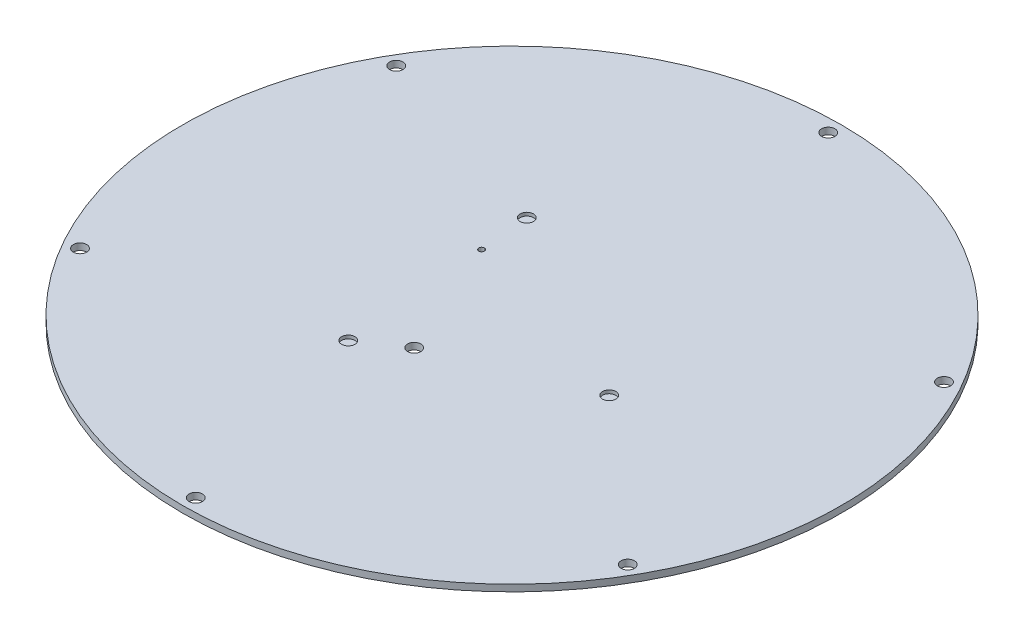
from build123d import *

# Parameters (mm, degrees)
SKETCH1_R               = 49.5
SKETCH1_R_2             = 1
BOSS_EXTRUDE1_DEPTH     = 1
CUT_EXTRUDE1_DEPTH      = 71.010713466
CUT_EXTRUDE1_DEPTH_BACK = 71.010713466
SKETCH2_R               = 1
SKETCH2_R_2             = 0.42
SKETCH3_R               = 1
CUT_EXTRUDE2_DEPTH      = 0.5


with BuildPart() as part:
    # Sketch1 → Boss-Extrude1 (new body)
    with BuildSketch(Plane(origin=(0, 0, 0), x_dir=(1, 0, 0), z_dir=(0, 1, 0))):
        Circle(SKETCH1_R)
        with Locations((0, 47.5)):
            Circle(SKETCH1_R_2, mode=Mode.SUBTRACT)
        with Locations((41.13620668, 23.75)):
            Circle(SKETCH1_R_2, mode=Mode.SUBTRACT)
        with Locations((41.13620668, -23.75)):
            Circle(SKETCH1_R_2, mode=Mode.SUBTRACT)
        with Locations((0, -47.5)):
            Circle(SKETCH1_R_2, mode=Mode.SUBTRACT)
        with Locations((-41.13620668, -23.75)):
            Circle(SKETCH1_R_2, mode=Mode.SUBTRACT)
        with Locations((-41.13620668, 23.75)):
            Circle(SKETCH1_R_2, mode=Mode.SUBTRACT)
    extrude(amount=BOSS_EXTRUDE1_DEPTH)

    # Sketch2 → Cut-Extrude1 (cut, two sides: drawn at the far end of the back side and taken through both)
    with BuildSketch(Plane(origin=(0, 1, 0), x_dir=(1, 0, 0), z_dir=(0, 1, 0)).offset(-CUT_EXTRUDE1_DEPTH_BACK)):
        with Locations((-3.105828541, -11.591109915)):
            Circle(SKETCH2_R)
        with Locations((-10.825317547, 6.25)):
            Circle(SKETCH2_R_2)
    extrude(amount=CUT_EXTRUDE1_DEPTH + CUT_EXTRUDE1_DEPTH_BACK, mode=Mode.SUBTRACT)

    # Sketch3 → Cut-Extrude2 (cut)
    with BuildSketch(Plane(origin=(0, 1, 0), x_dir=(1, 0, 0), z_dir=(0, 1, 0))):
        with Locations((-11.570176974, 13.788799976)):
            Circle(SKETCH3_R)
        with Locations((17.726539554, -3.125667198)):
            Circle(SKETCH3_R)
        with Locations((-9, -15.588457268)):
            Circle(SKETCH3_R)
    extrude(amount=-CUT_EXTRUDE2_DEPTH, mode=Mode.SUBTRACT)


solid = part.part
